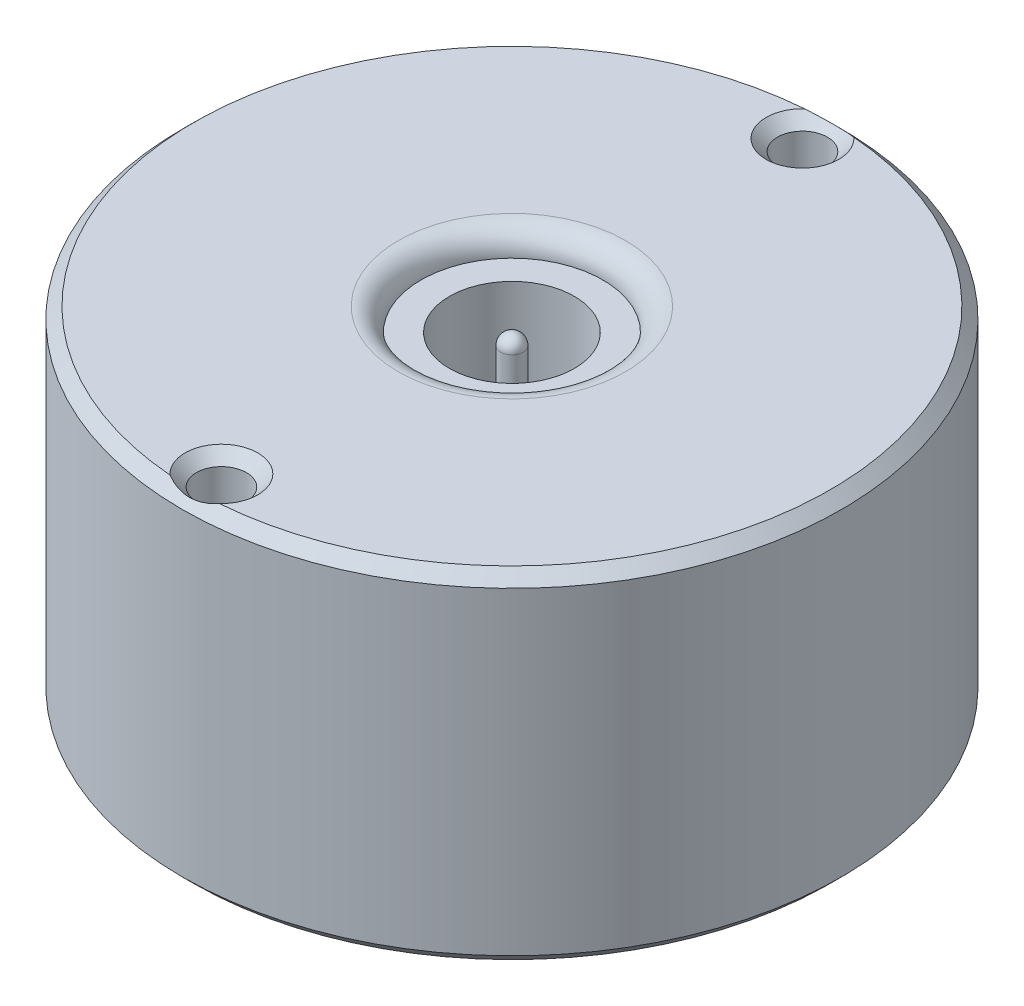
from build123d import *

# Parameters (mm, degrees)
SKETCH1_R           = 14.5
BOSS_EXTRUDE1_DEPTH = 15
SKETCH2_R           = 1.1
CUT_EXTRUDE1_DEPTH  = 15
CHAMFER1_SIZE       = 0.5
CHAMFER2_SIZE       = 0.5
SKETCH3_R           = 2.75
SKETCH3_R_2         = 0.5
CUT_EXTRUDE2_DEPTH  = 5
SKETCH4_R           = 4
CUT_EXTRUDE3_DEPTH  = 1
FILLET1_R           = 1
FILLET2_R           = 0.5


# Some blends are built 0.0001 mm under size
with BuildPart() as part:
    # Sketch1 → Boss-Extrude1 (new body)
    with BuildSketch(Plane(origin=(0, 0, 0), x_dir=(1, 0, 0), z_dir=(0, 1, 0))):
        with Locations(Location((0, 0, 0), (0, 0, 270))):
            Circle(SKETCH1_R)
    extrude(amount=BOSS_EXTRUDE1_DEPTH)

    # Sketch2 → Cut-Extrude1 (cut)
    with BuildSketch(Plane(origin=(0, 15, 0), x_dir=(1, 0, 0), z_dir=(0, 1, 0))):
        with Locations(Location((0, 12.781725236, 0), (0, 0, 270))):
            Circle(SKETCH2_R)
        with Locations(Location((0, -12.781725236, 0), (0, 0, 270))):
            Circle(SKETCH2_R)
    extrude(amount=-CUT_EXTRUDE1_DEPTH, mode=Mode.SUBTRACT)

    # Chamfer1
    chamfer1_edges = [part.edges().sort_by_distance(p)[0] for p in [
        (0, 15, -13.881725236),
        (0, 15, 11.681725236),
    ]]
    chamfer(chamfer1_edges, length=CHAMFER1_SIZE)

    # Chamfer2
    # the kernel refuses this chamfer: 0.5 mm, written as the material it takes off along each edge
    with BuildSketch(Plane(origin=(0, 0, 0), x_dir=(0, 0, 1), z_dir=(-1, 0, 0))) as chamfer2_piece_1:
        Polygon((14.5, CHAMFER2_SIZE), (14.5 - CHAMFER2_SIZE, 0), (14.5, 0), align=None)
    revolve(axis=Axis((0, 0, 0), (0, 1, 0)), mode=Mode.SUBTRACT)
    with BuildSketch(Plane(origin=(0, 15, 0), x_dir=(0, 0, 1), z_dir=(-1, 0, 0))) as chamfer2_piece_2:
        Polygon((14.5 - CHAMFER2_SIZE, 0), (14.5, -CHAMFER2_SIZE), (14.5, 0), align=None)
    revolve(axis=Axis((0, 15, 0), (0, 1, 0)), mode=Mode.SUBTRACT)

    # Sketch3 → Cut-Extrude2 (cut)
    with BuildSketch(Plane(origin=(0, 15, 0), x_dir=(1, 0, 0), z_dir=(0, 1, 0))):
        with Locations(Location((0, 0, 0), (0, 0, 270))):
            Circle(SKETCH3_R)
        with Locations(Location((0, 0, 0), (0, 0, 270))):
            Circle(SKETCH3_R_2, mode=Mode.SUBTRACT)
    extrude(amount=-CUT_EXTRUDE2_DEPTH, mode=Mode.SUBTRACT)

    # Sketch4 → Cut-Extrude3 (cut)
    with BuildSketch(Plane(origin=(0, 15, 0), x_dir=(1, 0, 0), z_dir=(0, 1, 0))):
        with Locations(Location((0, 0, 0), (0, 0, 270))):
            Circle(SKETCH4_R)
    extrude(amount=-CUT_EXTRUDE3_DEPTH, mode=Mode.SUBTRACT)

    # Fillet1
    fillet1_edges = [part.edges().sort_by_distance(p)[0] for p in [
        (0, 15, -4),
    ]]
    fillet(fillet1_edges, radius=FILLET1_R - 0.0001)  # a hair under: the kernel refuses the full size

    # Fillet2
    fillet2_edges = [part.edges().sort_by_distance(p)[0] for p in [
        (0, 14, -0.5),
    ]]
    fillet(fillet2_edges, radius=FILLET2_R)


solid = part.part
